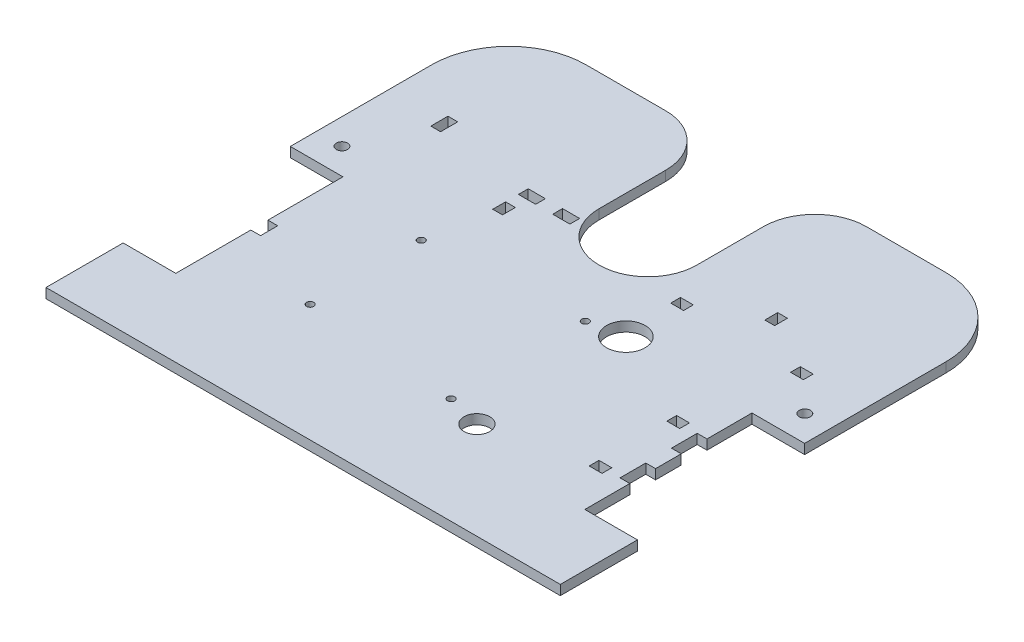
from build123d import *

# Parameters (mm, degrees)
SKETCH1_W           = 254
SKETCH1_H           = 228.6
BOSS_EXTRUDE1_DEPTH = 4.826
SKETCH2_W           = 26.00000007
SKETCH2_H           = 82.55
CUT_EXTRUDE1_DEPTH  = 4.826
CUT_EXTRUDE3_DEPTH  = 4.826
SKETCH17_R          = 2.778125
CUT_EXTRUDE14_DEPTH = 171.929167423
SKETCH18_W          = 4.826
SKETCH18_H          = 12.7
CUT_EXTRUDE15_DEPTH = 171.929167423
SKETCH19_W          = 4.826
SKETCH19_H          = 8.466666666
CUT_EXTRUDE16_DEPTH = 171.929167423
SKETCH20_W          = 6.35
SKETCH20_H          = 4.826
CUT_EXTRUDE17_DEPTH = 4.826
SKETCH21_R          = 1.778
CUT_EXTRUDE18_DEPTH = 171.929167423
SKETCH22_R          = 6.35
CUT_EXTRUDE19_DEPTH = 171.929167423
SKETCH24_R          = 24.13
CUT_EXTRUDE21_DEPTH = 171.929167423
SKETCH26_W          = 6.35
SKETCH26_H          = 4.826
SKETCH26_W_2        = 4.826
SKETCH26_H_2        = 6.35
CUT_EXTRUDE23_DEPTH = 171.929167423
SKETCH27_W          = 8.466666666
SKETCH27_H          = 4.826
SKETCH27_W_2        = 8.466666667
SKETCH27_W_3        = 4.826
SKETCH27_H_2        = 6.35
CUT_EXTRUDE24_DEPTH = 171.929167423
CUT_EXTRUDE25_DEPTH = 171.929167423
FILLET1_R           = 25.4
SKETCH29_R          = 9.525
CUT_EXTRUDE26_DEPTH = 171.929167423


with BuildPart() as part:
    # Sketch1 → Boss-Extrude1 (new body)
    with BuildSketch(Plane(origin=(0, 0, 0), x_dir=(1, 0, 0), z_dir=(0, 1, 0))):
        Rectangle(SKETCH1_W, SKETCH1_H)
    extrude(amount=BOSS_EXTRUDE1_DEPTH)

    # Sketch2 → Cut-Extrude1 (cut)
    with BuildSketch(Plane(origin=(0, 4.826, 0), x_dir=(1, 0, 0), z_dir=(0, 1, 0))):
        with Locations((-113.999999965, -34.925)):
            Rectangle(SKETCH2_W, SKETCH2_H)
        with Locations((113.999999965, -34.925)):
            Rectangle(SKETCH2_W, SKETCH2_H)
    extrude(amount=-CUT_EXTRUDE1_DEPTH, mode=Mode.SUBTRACT)

    # Sketch4 → Cut-Extrude3 (cut)
    with BuildSketch(Plane(origin=(0, 4.826, 0), x_dir=(1, 0, 0), z_dir=(0, 1, 0))):
        with BuildLine():
            Line((-127, 76.2), (-127, 114.3))
            Line((-127, 114.3), (-88.9, 114.3))
            ThreePointArc((-88.9, 114.3), (-115.840768363, 103.140768363), (-127, 76.2))
        make_face()
        with BuildLine():
            Line((127, 76.2), (127, 114.3))
            Line((127, 114.3), (88.9, 114.3))
            ThreePointArc((88.9, 114.3), (115.840768363, 103.140768363), (127, 76.2))
        make_face()
    extrude(amount=-CUT_EXTRUDE3_DEPTH, mode=Mode.SUBTRACT)

    # Sketch17 → Cut-Extrude14 (cut, through all)
    with BuildSketch(Plane.XZ):
        with Locations((114.3, -19.164632523)):
            Circle(SKETCH17_R)
        with Locations((-114.3, -19.164632523)):
            Circle(SKETCH17_R)
    extrude(amount=-CUT_EXTRUDE14_DEPTH, mode=Mode.SUBTRACT)

    # Sketch18 → Cut-Extrude15 (cut, through all)
    with BuildSketch(Plane(origin=(0, 4.826, 0), x_dir=(1, 0, 0), z_dir=(0, 1, 0))):
        with Locations((98.58699993, -47.625)):
            Rectangle(SKETCH18_W, SKETCH18_H)
        with Locations((98.58699993, -22.225)):
            Rectangle(SKETCH18_W, SKETCH18_H)
    extrude(amount=-CUT_EXTRUDE15_DEPTH, mode=Mode.SUBTRACT)

    # Sketch19 → Cut-Extrude16 (cut, through all)
    with BuildSketch(Plane(origin=(0, 4.826, 0), x_dir=(1, 0, 0), z_dir=(0, 1, 0))):
        with Locations((-98.58699993, -34.925)):
            Rectangle(SKETCH19_W, SKETCH19_H)
        with Locations((-98.58699993, 53.975)):
            Rectangle(SKETCH19_W, SKETCH19_H)
    extrude(amount=-CUT_EXTRUDE16_DEPTH, mode=Mode.SUBTRACT)

    # Sketch20 → Cut-Extrude17 (cut)
    with BuildSketch(Plane.XZ):
        with Locations((86.64899993, 54.102)):
            Rectangle(SKETCH20_W, SKETCH20_H)
        with Locations((86.64899993, 15.748)):
            Rectangle(SKETCH20_W, SKETCH20_H)
    extrude(amount=-CUT_EXTRUDE17_DEPTH, mode=Mode.SUBTRACT)

    # Sketch21 → Cut-Extrude18 (cut, through all)
    with BuildSketch(Plane(origin=(0, 4.826, 0), x_dir=(1, 0, 0), z_dir=(0, 1, 0))):
        with Locations((-54.548927696, -56.293994427)):
            Circle(SKETCH21_R)
        with Locations((-54.548927696, -1.429994427)):
            Circle(SKETCH21_R)
        with Locations((20.635072304, -61.881994427)):
            Circle(SKETCH21_R)
        with Locations((20.635072304, 4.412005573)):
            Circle(SKETCH21_R)
    extrude(amount=-CUT_EXTRUDE18_DEPTH, mode=Mode.SUBTRACT)

    # Sketch22 → Cut-Extrude19 (cut, through all)
    with BuildSketch(Plane(origin=(0, 4.826, 0), x_dir=(1, 0, 0), z_dir=(0, 1, 0))):
        with Locations((37.84899924, -66.33273812)):
            Circle(SKETCH22_R)
    extrude(amount=-CUT_EXTRUDE19_DEPTH, mode=Mode.SUBTRACT)

    # Sketch24 → Cut-Extrude21 (cut, through all)
    with BuildSketch(Plane.XZ):
        with Locations((0, -55.982011538)):
            Circle(SKETCH24_R)
    extrude(amount=-CUT_EXTRUDE21_DEPTH, mode=Mode.SUBTRACT)

    # Sketch26 → Cut-Extrude23 (cut, through all)
    with BuildSketch(Plane(origin=(0, 4.826, 0), x_dir=(1, 0, 0), z_dir=(0, 1, 0))):
        with Locations((96.30099993, 35.687)):
            Rectangle(SKETCH26_W, SKETCH26_H)
        with Locations((66.83699993, 52.451)):
            Rectangle(SKETCH26_W_2, SKETCH26_H_2)
        with Locations((37.11899993, 35.687)):
            Rectangle(SKETCH26_W, SKETCH26_H)
    extrude(amount=-CUT_EXTRUDE23_DEPTH, mode=Mode.SUBTRACT)

    # Sketch27 → Cut-Extrude24 (cut, through all)
    with BuildSketch(Plane.XZ):
        with Locations((-45.903190174, -44.577)):
            Rectangle(SKETCH27_W, SKETCH27_H)
        with Locations((-28.969856841, -44.577)):
            Rectangle(SKETCH27_W_2, SKETCH27_H)
        with Locations((-47.723523507, -32.639)):
            Rectangle(SKETCH27_W_3, SKETCH27_H_2)
    extrude(amount=-CUT_EXTRUDE24_DEPTH, mode=Mode.SUBTRACT)

    # Sketch28 → Cut-Extrude25 (cut, through all)
    with BuildSketch(Plane(origin=(0, 4.826, 0), x_dir=(1, 0, 0), z_dir=(0, 1, 0))):
        with BuildLine():
            Line((-24.13, 114.3), (-24.13, 55.982011538))
            ThreePointArc((-24.13, 55.982011538), (0, 80.112011538), (24.13, 55.982011538))
            Line((24.13, 55.982011538), (24.13, 114.3))
            Line((24.13, 114.3), (-24.13, 114.3))
        make_face()
    extrude(amount=-CUT_EXTRUDE25_DEPTH, mode=Mode.SUBTRACT)

    # Fillet1
    fillet1_edges = [part.edges().sort_by_distance(p)[0] for p in [
        (-24.13, 2.413, -114.3),
        (24.13, 2.413, -114.3),
    ]]
    fillet(fillet1_edges, radius=FILLET1_R)

    # Sketch29 → Cut-Extrude26 (cut, through all)
    with BuildSketch(Plane(origin=(0, 4.826, 0), x_dir=(1, 0, 0), z_dir=(0, 1, 0))):
        with Locations((37.217780155, 7.874)):
            Circle(SKETCH29_R)
    extrude(amount=-CUT_EXTRUDE26_DEPTH, mode=Mode.SUBTRACT)


solid = part.part
